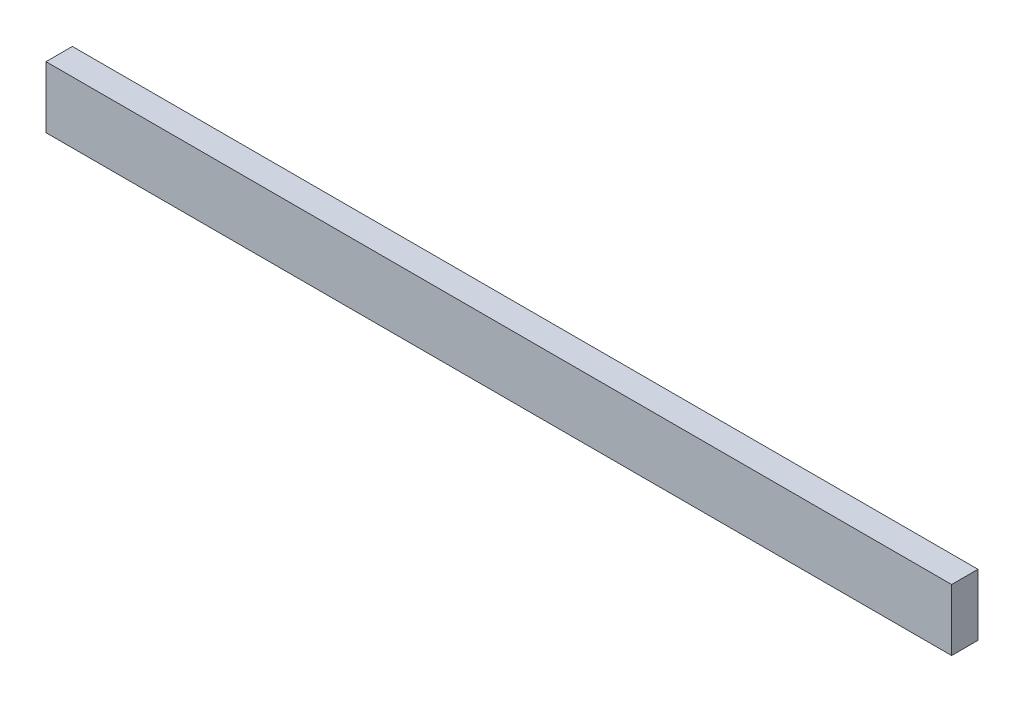
from build123d import *

# Parameters (mm, degrees)
SKETCH1_W           = 38.1
SKETCH1_H           = 88.9
BOSS_EXTRUDE1_DEPTH = 1308.1


with BuildPart() as part:
    # Sketch1 → Boss-Extrude1 (new body)
    with BuildSketch(Plane(origin=(0, 0, 0), x_dir=(0, 0, -1), z_dir=(1, 0, 0))):
        Rectangle(SKETCH1_W, SKETCH1_H)
    extrude(amount=BOSS_EXTRUDE1_DEPTH)


solid = part.part
